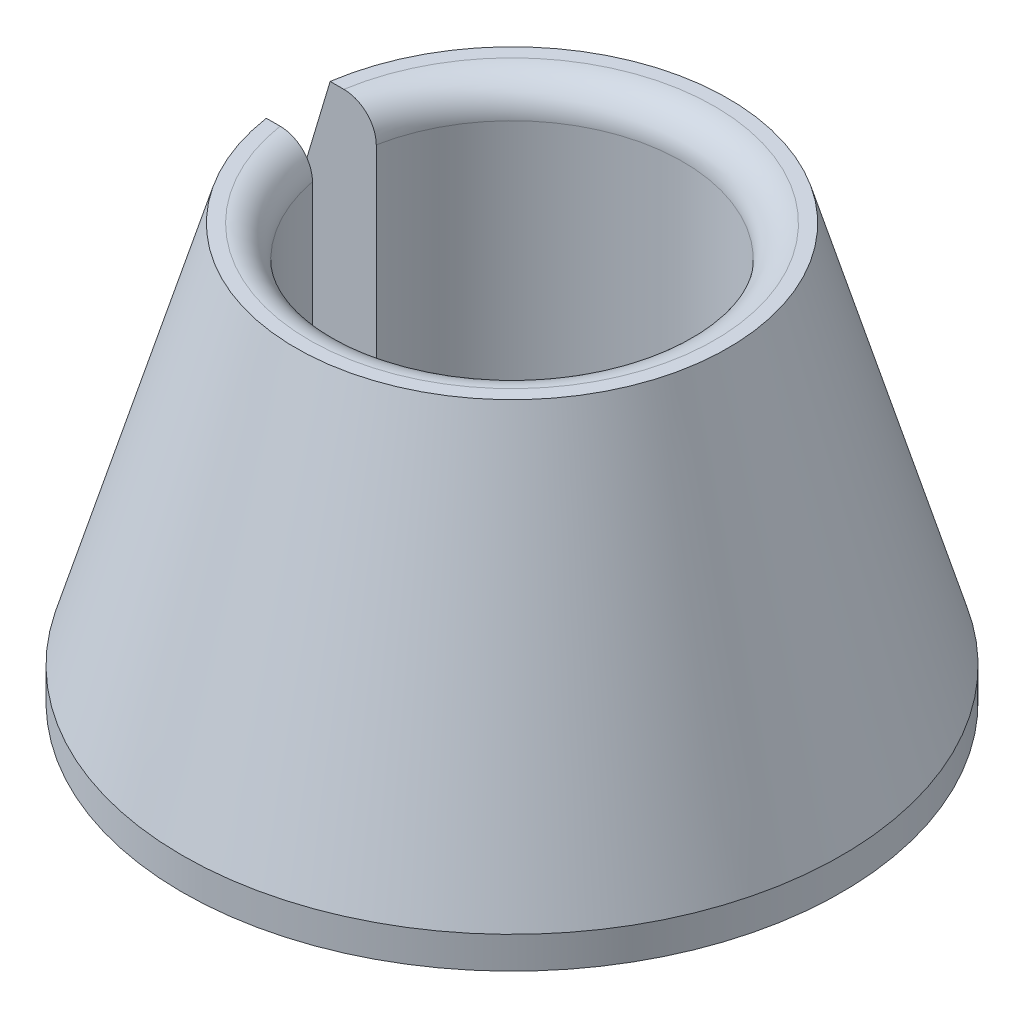
from build123d import *

# Parameters (mm, degrees)
SKETCH1_R           = 5.164999999999999
SKETCH1_R_2         = 2.675
BOSS_EXTRUDE1_DEPTH = 6
CHAMFER1_SIZE       = 6
CHAMFER1_SIZE_2     = 1.77728097
CUT_EXTRUDE1_DEPTH  = 10.452748277617466
BOSS_EXTRUDE2_START = 0.5
BOSS_EXTRUDE2_DEPTH = 0.5
FILLET1_R           = 0.5


with BuildPart() as part:
    # Sketch1 → Boss-Extrude1 (new body)
    with BuildSketch(Plane(origin=(0, 0, 0), x_dir=(1, 0, 0), z_dir=(0, 1, 0))):
        with Locations(Location((0, 0, 0), (0, 0, 270))):
            Circle(SKETCH1_R)
        with Locations(Location((0, 0, 0), (0, 0, 270))):
            Circle(SKETCH1_R_2, mode=Mode.SUBTRACT)
    extrude(amount=BOSS_EXTRUDE1_DEPTH)

    # Chamfer1
    # the kernel refuses this chamfer: 6, 1.77728097 mm, written as the material it takes off along each edge
    with BuildSketch(Plane(origin=(0, 6, 0), x_dir=(-1.8e-16, 0, 1), z_dir=(-1, 0, -1.8e-16))) as chamfer1_piece_1:
        Polygon((5.164999999999999, -CHAMFER1_SIZE), (5.164999999999999 - CHAMFER1_SIZE_2, 0), (5.164999999999999, 0), align=None)
    revolve(axis=Axis((0, 6, 0), (0, 1, 0)), mode=Mode.SUBTRACT)

    # Sketch2 → Cut-Extrude1 (cut, through all)
    with BuildSketch(Plane(origin=(0, 6, 0), x_dir=(1, 0, 0), z_dir=(0, 1, 0))):
        Polygon((-6e-17, 0.5), (-6.017243985575578, 0.4999999999999993), (-6.017243985575578, -0.5000000000000008), (6e-17, -0.5), align=None)
    extrude(amount=-CUT_EXTRUDE1_DEPTH, mode=Mode.SUBTRACT)

    # Sketch3 → Boss-Extrude2 (add)
    with BuildSketch(Plane.XZ.offset(BOSS_EXTRUDE2_START)):
        with BuildLine():
            Line((-2.6278555896395814, -0.4999999999999993), (-5.140741678007149, -0.49999999999999917))
            ThreePointArc((-5.140741678007149, -0.49999999999999917), (5.164999999999977, -2.29e-15), (-5.140741678007172, 0.5000000000000027))
            Line((-5.140741678007172, 0.5000000000000027), (-2.627855589639582, 0.5000000000000001))
            ThreePointArc((-2.627855589639582, 0.5000000000000001), (2.6749999999999985, 0), (-2.6278555896395814, -0.4999999999999993))
        make_face()
    extrude(amount=-BOSS_EXTRUDE2_DEPTH)

    # Fillet1
    fillet1_edges = [part.edges().sort_by_distance(p)[0] for p in [
        (2.6750000000000003, 6, -1.288e-14),
        (2.674999999999999, -0.5, 5.4e-16),
    ]]
    fillet(fillet1_edges, radius=FILLET1_R)


solid = part.part
